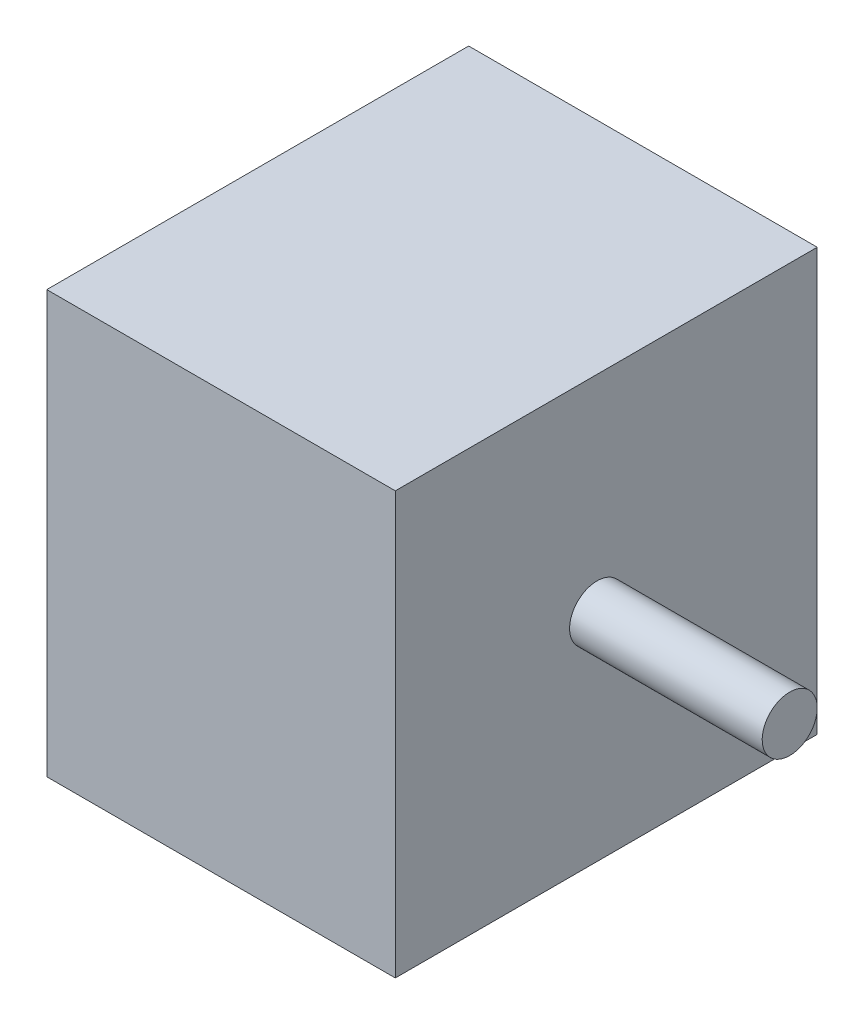
from build123d import *

# Parameters (mm, degrees)
ESQUISSE1_W                   = 44.2
ESQUISSE1_H                   = 52.2
BOSS_EXTRU_1_DEPTH            = 52.2
ENL_V_MAT_EXTRU_2_DEPTH       = 74.209903702
ENL_V_MAT_EXTRU_2_DEPTH_BACK  = 44.2
ENL_V_MAT_EXTRU_3_DEPTH       = 74.209903702
ENL_V_MAT_EXTRU_3_DEPTH_BACK  = 44.2
ENL_V_MAT_EXTRU_4_DEPTH       = 78.059003368
ENL_V_MAT_EXTRU_4_DEPTH_BACK  = 46
ENL_V_MAT_EXTRU_5_DEPTH       = 78.059003368
ENL_V_MAT_EXTRU_5_DEPTH_BACK  = 46
ENL_V_MAT_EXTRU_7_DEPTH       = 45.550224466
ENL_V_MAT_EXTRU_7_DEPTH_BACK  = 45.550224466
ENL_V_MAT_EXTRU_8_DEPTH       = 78.059003368
ENL_V_MAT_EXTRU_8_DEPTH_BACK  = 46
ENL_V_MAT_EXTRU_9_DEPTH       = 75.993733072
ENL_V_MAT_EXTRU_9_DEPTH_BACK  = 46
ESQUISSE13_R                  = 3
BOSS_EXTRU_2_DEPTH            = 21
ENL_V_MAT_EXTRU_10_DEPTH      = 84.625713749
ENL_V_MAT_EXTRU_10_DEPTH_BACK = 49
ENL_V_MAT_EXTRU_11_DEPTH      = 82.074163579
ENL_V_MAT_EXTRU_11_DEPTH_BACK = 49


with BuildPart() as part:
    # Esquisse1 → Boss.-Extru.1 (new body)
    with BuildSketch(Plane.XY):
        Rectangle(ESQUISSE1_W, ESQUISSE1_H)
    extrude(amount=BOSS_EXTRU_1_DEPTH)

    # Esquisse2 → Enlèv. mat.-Extru.2 (cut, two sides: drawn at the far end of the back side and taken through both)
    with BuildSketch(Plane(origin=(22.1, 0, 0), x_dir=(0, 0, -1), z_dir=(1, 0, 0)).offset(-ENL_V_MAT_EXTRU_2_DEPTH_BACK)):
        Polygon((-201.352290675, -19.9), (-52.2, -19.9), (-28.55, -19.9), (-28.55, -21.45), (-32.25, -21.45), (-32.25, -22.45), (-28.745559959, -26.1), (74.553898465, -133.690091099), (-39.180744024, -409.461834307), (-315.086933163, -295.671743208), align=None)
    extrude(amount=ENL_V_MAT_EXTRU_2_DEPTH + ENL_V_MAT_EXTRU_2_DEPTH_BACK, mode=Mode.SUBTRACT)

    # Esquisse3 → Enlèv. mat.-Extru.3 (cut, two sides: drawn at the far end of the back side and taken through both)
    with BuildSketch(Plane(origin=(22.1, 0, 0), x_dir=(0, 0, -1), z_dir=(1, 0, 0)).offset(-ENL_V_MAT_EXTRU_3_DEPTH_BACK)):
        Polygon((149.152290675, -19.9), (0, -19.9), (-23.65, -19.9), (-23.65, -21.45), (-19.95, -21.45), (-19.95, -22.45), (-23.454440041, -26.1), (-126.753898465, -133.690091099), (-13.019255976, -409.461834307), (262.886933163, -295.671743208), align=None)
    extrude(amount=ENL_V_MAT_EXTRU_3_DEPTH + ENL_V_MAT_EXTRU_3_DEPTH_BACK, mode=Mode.SUBTRACT)

    # Esquisse4 → Enlèv. mat.-Extru.4 (cut, two sides: drawn at the far end of the back side and taken through both)
    with BuildSketch(Plane(origin=(0, 26.1, 0), x_dir=(1, 0, 0), z_dir=(0, 1, 0)).offset(-ENL_V_MAT_EXTRU_4_DEPTH_BACK)):
        Polygon((-15.9, -191.333109619), (-15.9, -52.2), (-15.9, -28.55), (-17.45, -28.55), (-17.45, -32.25), (-18.45, -32.25), (-22.1, -28.745559959), (-122.462816227, 67.614843274), (-379.791464965, -38.281593439), (-273.228648738, -297.229546332), align=None)
    extrude(amount=ENL_V_MAT_EXTRU_4_DEPTH + ENL_V_MAT_EXTRU_4_DEPTH_BACK, mode=Mode.SUBTRACT)

    # Esquisse5 → Enlèv. mat.-Extru.5 (cut, two sides: drawn at the far end of the back side and taken through both)
    with BuildSketch(Plane(origin=(0, 26.1, 0), x_dir=(1, 0, 0), z_dir=(0, 1, 0)).offset(-ENL_V_MAT_EXTRU_5_DEPTH_BACK)):
        Polygon((-15.9, 139.133109619), (-15.9, 0), (-15.9, -23.65), (-17.45, -23.65), (-17.45, -19.95), (-18.45, -19.95), (-22.1, -23.454440041), (-122.462816228, -119.814843274), (-379.791464965, -13.918406561), (-273.228648738, 245.029546332), align=None)
    extrude(amount=ENL_V_MAT_EXTRU_5_DEPTH + ENL_V_MAT_EXTRU_5_DEPTH_BACK, mode=Mode.SUBTRACT)

    # Esquisse6 → Enlèv. mat.-Extru.7 (cut, two sides: drawn at the far end of the back side and taken through both)
    with BuildSketch(Plane.XY.offset(28.55).offset(-ENL_V_MAT_EXTRU_7_DEPTH_BACK)):
        Polygon((-161.22284167, -19.9), (-22.1, -19.9), (-15.9, -19.9), (-15.9, -26.093649616), (-15.9, -165.216491285), (-212.645110561, -361.97019968), (-357.967952231, -216.653708395), align=None)
    extrude(amount=ENL_V_MAT_EXTRU_7_DEPTH + ENL_V_MAT_EXTRU_7_DEPTH_BACK, mode=Mode.SUBTRACT)

    # Esquisse11 → Enlèv. mat.-Extru.8 (cut, two sides: drawn at the far end of the back side and taken through both)
    with BuildSketch(Plane(origin=(0, 26.1, 0), x_dir=(1, 0, 0), z_dir=(0, 1, 0)).offset(-ENL_V_MAT_EXTRU_8_DEPTH_BACK)):
        Polygon((164.227968273, -49.1), (22.1, -49.1), (-15.9, -49.1), (-158.027968273, -49.1), (-158.027968273, -333.355936546), (164.227968273, -333.355936546), align=None)
    extrude(amount=ENL_V_MAT_EXTRU_8_DEPTH + ENL_V_MAT_EXTRU_8_DEPTH_BACK, mode=Mode.SUBTRACT)

    # Esquisse12 → Enlèv. mat.-Extru.9 (cut, two sides: drawn at the far end of the back side and taken through both)
    with BuildSketch(Plane(origin=(0, 26.1, 0), x_dir=(1, 0, 0), z_dir=(0, 1, 0)).offset(-ENL_V_MAT_EXTRU_9_DEPTH_BACK)):
        Polygon((159.687460199, -3.1), (22.1, -3.1), (-15.9, -3.1), (-153.487460199, -3.1), (-153.487460199, 272.074920398), (159.687460199, 272.074920398), align=None)
    extrude(amount=ENL_V_MAT_EXTRU_9_DEPTH + ENL_V_MAT_EXTRU_9_DEPTH_BACK, mode=Mode.SUBTRACT)

    # Esquisse13 → Boss.-Extru.2 (add)
    with BuildSketch(Plane(origin=(22.1, 0, 0), x_dir=(0, 0, -1), z_dir=(1, 0, 0))):
        with Locations((-27.1, 3.6)):
            Circle(ESQUISSE13_R)
    extrude(amount=BOSS_EXTRU_2_DEPTH)

    # Esquisse15 → Enlèv. mat.-Extru.10 (cut, two sides: drawn at the far end of the back side and taken through both)
    with BuildSketch(Plane(origin=(0, 26.1, 0), x_dir=(1, 0, 0), z_dir=(0, 1, 0)).offset(-ENL_V_MAT_EXTRU_10_DEPTH_BACK)):
        Polygon((-15.9, 114.859960703), (-15.9, -23.65), (-15.9, -28.55), (-15.9, -167.059960703), (-292.919921407, -167.059960703), (-292.919921407, 114.859960703), align=None)
    extrude(amount=ENL_V_MAT_EXTRU_10_DEPTH + ENL_V_MAT_EXTRU_10_DEPTH_BACK, mode=Mode.SUBTRACT)

    # Esquisse16 → Enlèv. mat.-Extru.11 (cut, two sides: drawn at the far end of the back side and taken through both)
    with BuildSketch(Plane.ZY.offset(15.9).offset(-ENL_V_MAT_EXTRU_11_DEPTH_BACK)):
        Polygon((-91.491856556, -19.9), (23.65, -19.9), (28.55, -19.9), (143.691856556, -19.9), (143.691856556, -250.183713112), (-91.491856556, -250.183713112), align=None)
    extrude(amount=ENL_V_MAT_EXTRU_11_DEPTH + ENL_V_MAT_EXTRU_11_DEPTH_BACK, mode=Mode.SUBTRACT)


solid = part.part
